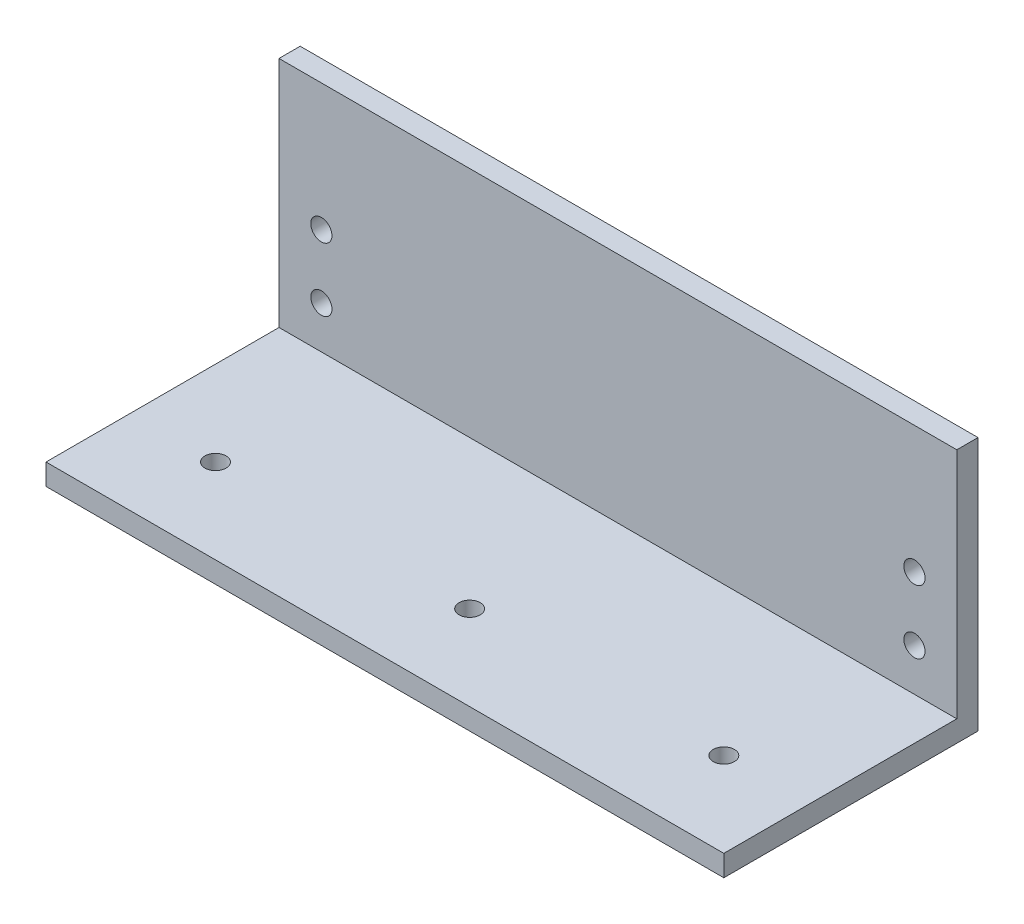
from build123d import *

# Parameters (mm, degrees)
BOSS_EXTRUDE2_DEPTH = 203.2
SKETCH4_R           = 3.175
CUT_EXTRUDE1_DEPTH  = 71.628
SKETCH5_R           = 3.175
CUT_EXTRUDE2_DEPTH  = 244.602


with BuildPart() as part:
    # Sketch2 → Boss-Extrude2 (new body)
    with BuildSketch(Plane(origin=(0, 0, 0), x_dir=(0, 0, -1), z_dir=(1, 0, 0))):
        Polygon((0, 6.35), (0, 0), (76.2, 0), (76.2, 76.2), (69.85, 76.2), (69.85, 6.35), align=None)
    extrude(amount=BOSS_EXTRUDE2_DEPTH)

    # Sketch4 → Cut-Extrude1 (cut)
    with BuildSketch(Plane(origin=(0, 0, -76.2), x_dir=(-1, 0, 0), z_dir=(0, 0, -1))):
        with Locations((-190.5, 19.05)):
            Circle(SKETCH4_R)
        with Locations((-190.5, 38.1)):
            Circle(SKETCH4_R)
        with Locations((-12.7, 19.05)):
            Circle(SKETCH4_R)
        with Locations((-12.7, 38.1)):
            Circle(SKETCH4_R)
    extrude(amount=-CUT_EXTRUDE1_DEPTH, mode=Mode.SUBTRACT)

    # Sketch5 → Cut-Extrude2 (cut)
    with BuildSketch(Plane(origin=(0, 6.35, 0), x_dir=(1, 0, 0), z_dir=(0, 1, 0))):
        with Locations((25.4, 25.4)):
            Circle(SKETCH5_R)
        with Locations((177.8, 25.4)):
            Circle(SKETCH5_R)
        with Locations((101.6, 25.4)):
            Circle(SKETCH5_R)
    extrude(amount=-CUT_EXTRUDE2_DEPTH, mode=Mode.SUBTRACT)


solid = part.part
